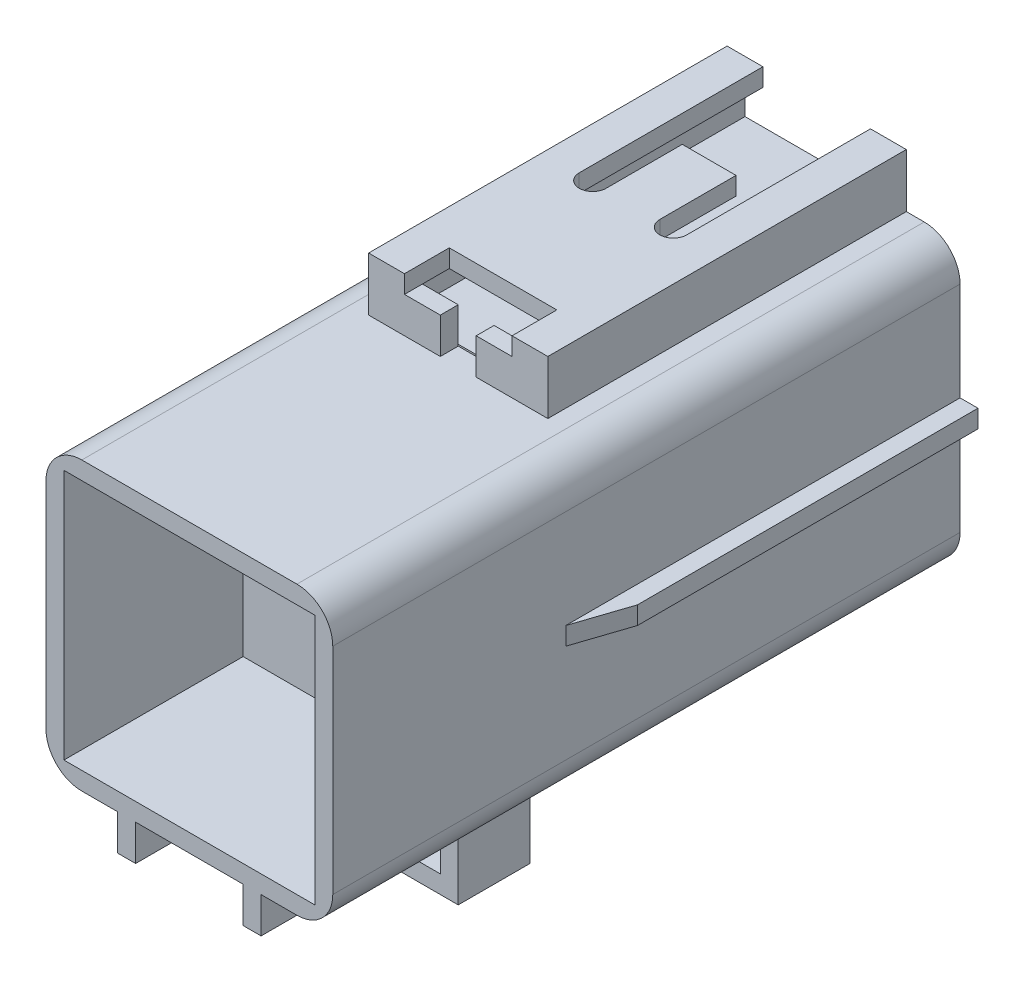
from build123d import *

# Parameters (mm, degrees)
SKETCH_1_W           = 16
SKETCH_1_H           = 16
EXTRUDE_1_DEPTH      = 35
FILLET_1_R           = 2
SKETCH_2_W           = 8
SKETCH_2_H           = 15
EXTRUDE_2_DEPTH      = 6
CUT_EXTRUDE_2_REACH  = 40.536
SKETCH_3_W           = 6
SKETCH_3_H           = 5
SKETCH_7_W           = 8
SKETCH_7_H           = 4
CUT_EXTRUDE_4_DEPTH  = 11
SKETCH_8_W           = 10
SKETCH_8_H           = 20
EXTRUDE_3_DEPTH      = 3
SKETCH_9_W           = 6
SKETCH_9_H           = 2.5
CUT_EXTRUDE_5_DEPTH  = 1
FILLET_2_R           = 0.75
SKETCH_10_R          = 2.5
CUT_EXTRUDE_6_DEPTH  = 10
SKETCH_11_W          = 14
SKETCH_11_H          = 14
CUT_EXTRUDE_7_DEPTH  = 10
SKETCH_12_W          = 8
SKETCH_12_H          = 1.908274713
CUT_EXTRUDE_8_DEPTH  = 19
SKETCH_13_W          = 2
SKETCH_13_H          = 1
CUT_EXTRUDE_9_DEPTH  = 2
SKETCH_14_W          = 22
SKETCH_14_H          = 1
EXTRUDE_4_DEPTH      = 1
CUT_EXTRUDE_10_DEPTH = 1


with BuildPart() as part:
    # ｽｹｯﾁ1 → ﾎﾞｽ - 押し出し1 (new body)
    with BuildSketch(Plane.XY):
        Rectangle(SKETCH_1_W, SKETCH_1_H)
    extrude(amount=EXTRUDE_1_DEPTH)

    # ﾌｨﾚｯﾄ1
    fillet_1_edges = [part.edges().sort_by_distance(p)[0] for p in [
        (-8, 8, 17.5),
        (8, 8, 17.5),
        (8, -8, 17.5),
        (-8, -8, 17.5),
    ]]
    fillet(fillet_1_edges, radius=FILLET_1_R)

    # ｽｹｯﾁ2 → ﾎﾞｽ - 押し出し2 (add)
    with BuildSketch(Plane.XZ.offset(8)):
        with Locations((0, 27.5)):
            Rectangle(SKETCH_2_W, SKETCH_2_H)
    extrude(amount=EXTRUDE_2_DEPTH)

    # ｽｹｯﾁ3 → ｶｯﾄ - 押し出し2 (cut, up to next)
    with BuildSketch(Plane.XY.offset(35), mode=Mode.PRIVATE) as cut_extrude_2_sk1:
        with Locations((0, -10.5)):
            Rectangle(SKETCH_3_W, SKETCH_3_H)
    cut_extrude_2_tool1 = extrude(cut_extrude_2_sk1.sketch, amount=-CUT_EXTRUDE_2_REACH, mode=Mode.PRIVATE) & part.part
    add(cut_extrude_2_tool1.solids().sort_by_distance((0, -10.5, 35))[0], mode=Mode.SUBTRACT)

    # ｽｹｯﾁ7 → ｶｯﾄ - 押し出し4 (cut)
    with BuildSketch(Plane.XY.offset(35)):
        with Locations((0, -12)):
            Rectangle(SKETCH_7_W, SKETCH_7_H)
    extrude(amount=-CUT_EXTRUDE_4_DEPTH, mode=Mode.SUBTRACT)

    # ｽｹｯﾁ8 → ﾎﾞｽ - 押し出し3 (add)
    with BuildSketch(Plane(origin=(0, 8, 0), x_dir=(1, 0, 0), z_dir=(0, 1, 0))):
        with Locations((0, -10)):
            Rectangle(SKETCH_8_W, SKETCH_8_H)
    extrude(amount=EXTRUDE_3_DEPTH)

    # ｽｹｯﾁ9 → ｶｯﾄ - 押し出し5 (cut)
    with BuildSketch(Plane(origin=(0, 11, 0), x_dir=(1, 0, 0), z_dir=(0, 1, 0))):
        Polygon((3, 0), (3, -11), (1.5, -11), (1.5, -6), (-1.5, -6), (-1.5, -11), (-3, -11), (-3, 0), align=None)
        with Locations((0, -18.75)):
            Rectangle(SKETCH_9_W, SKETCH_9_H)
    extrude(amount=-CUT_EXTRUDE_5_DEPTH, mode=Mode.SUBTRACT)

    # ﾌｨﾚｯﾄ2
    fillet_2_edges = [part.edges().sort_by_distance(p)[0] for p in [
        (-3, 10.5, 11),
        (-1.5, 10.5, 11),
        (1.5, 10.5, 11),
        (3, 10.5, 11),
    ]]
    fillet(fillet_2_edges, radius=FILLET_2_R - 0.0001)  # a hair under: the kernel refuses the full size

    # ｽｹｯﾁ10 → ｶｯﾄ - 押し出し6 (cut)
    with BuildSketch(Plane(origin=(0, 0, 0), x_dir=(-1, 0, 0), z_dir=(0, 0, -1))):
        with Locations((-3.1, 3.1)):
            Circle(SKETCH_10_R)
        with Locations(Location((3.1, 3.1, 0), (0, 0, 180))):
            Circle(SKETCH_10_R)
        with Locations((3.1, -3.1)):
            Circle(SKETCH_10_R)
        with Locations(Location((-3.1, -3.1, 0), (0, 0, 180))):
            Circle(SKETCH_10_R)
    extrude(amount=-CUT_EXTRUDE_6_DEPTH, mode=Mode.SUBTRACT)

    # ｽｹｯﾁ11 → ｶｯﾄ - 押し出し7 (cut)
    with BuildSketch(Plane.XY.offset(35)):
        Rectangle(SKETCH_11_W, SKETCH_11_H)
    extrude(amount=-CUT_EXTRUDE_7_DEPTH, mode=Mode.SUBTRACT)

    # ｽｹｯﾁ12 → ｶｯﾄ - 押し出し8 (cut)
    with BuildSketch(Plane(origin=(0, 0, 0), x_dir=(-1, 0, 0), z_dir=(0, 0, -1))):
        with Locations((0, 9.045862644)):
            Rectangle(SKETCH_12_W, SKETCH_12_H)
    extrude(amount=-CUT_EXTRUDE_8_DEPTH, mode=Mode.SUBTRACT)

    # ｽｹｯﾁ13 → ｶｯﾄ - 押し出し9 (cut)
    with BuildSketch(Plane(origin=(0, 10, 0), x_dir=(1, 0, 0), z_dir=(0, 1, 0))):
        with Locations((0, -19.5)):
            Rectangle(SKETCH_13_W, SKETCH_13_H)
    extrude(amount=-CUT_EXTRUDE_9_DEPTH, mode=Mode.SUBTRACT)

    # ｽｹｯﾁ14 → ﾎﾞｽ - 押し出し4 (add)
    with BuildSketch(Plane(origin=(8, 0, 0), x_dir=(0, 0, -1), z_dir=(1, 0, 0))):
        with Locations((-11, 0)):
            Rectangle(SKETCH_14_W, SKETCH_14_H)
    extrude_4 = extrude(amount=EXTRUDE_4_DEPTH)

    # ｽｹｯﾁ16 → ｶｯﾄ - 押し出し10 (cut)
    with BuildSketch(Plane(origin=(0, 0.5, 0), x_dir=(1, 0, 0), z_dir=(0, 1, 0))):
        Polygon((8, -22), (9, -22), (9, -19), align=None)
    cut_extrude_10 = extrude(amount=-CUT_EXTRUDE_10_DEPTH, mode=Mode.SUBTRACT)

    # ﾐﾗｰ1: ﾎﾞｽ - 押し出し4 across plane
    add(extrude_4.mirror(Plane(origin=(0, 0, 0), x_dir=(0, 0, 1), z_dir=(1, 0, 0))))

    # ﾐﾗｰ2: ｶｯﾄ - 押し出し10 across plane
    add(cut_extrude_10.mirror(Plane(origin=(0, 0, 0), x_dir=(0, 0, 1), z_dir=(1, 0, 0))), mode=Mode.SUBTRACT)


solid = part.part
